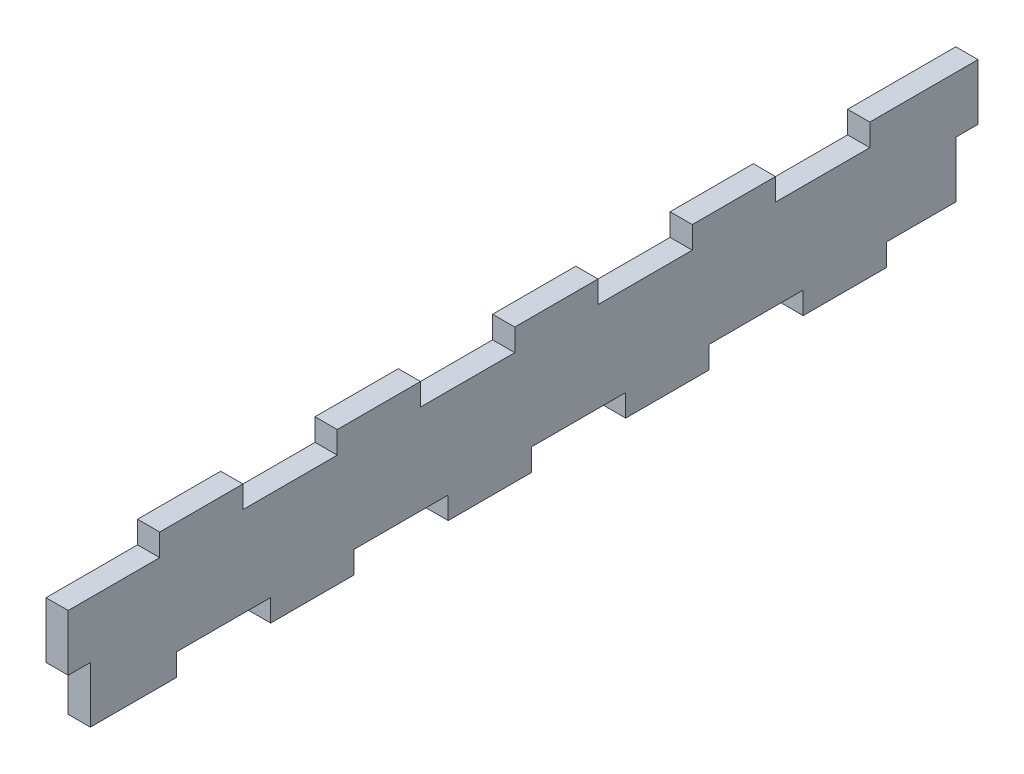
from build123d import *

# Parameters (mm, degrees)
ESQUISSE1_W             = 82
ESQUISSE1_H             = 12.11
BOSS_EXTRU_1_DEPTH      = 2
ESQUISSE2_W             = 8.5
ESQUISSE2_H             = 2.25
ENL_V_MAT_EXTRU_1_DEPTH = 42.581069992
ESQUISSE3_W             = 8.5
ESQUISSE3_H             = 2
ENL_V_MAT_EXTRU_2_DEPTH = 42.581069992
ESQUISSE4_W             = 2
ESQUISSE4_H             = 5.055
ENL_V_MAT_EXTRU_3_DEPTH = 42.581069992


with BuildPart() as part:
    # Esquisse1 → Boss.-Extru.1 (new body)
    with BuildSketch(Plane(origin=(0, 0, 0), x_dir=(0, 0, -1), z_dir=(1, 0, 0))):
        with Locations((-0.0892, 0)):
            Rectangle(ESQUISSE1_W, ESQUISSE1_H)
    extrude(amount=BOSS_EXTRU_1_DEPTH)

    # Esquisse2 → Enlèv. mat.-Extru.1 (cut, through all)
    with BuildSketch(Plane(origin=(0, 0, 0), x_dir=(0, 0, -1), z_dir=(1, 0, 0))):
        with Locations((-37.0892, 5.18)):
            Rectangle(ESQUISSE2_W, ESQUISSE2_H)
        with Locations((-21.0892, 5.18)):
            Rectangle(ESQUISSE2_W, ESQUISSE2_H)
        with Locations((-5.0892, 5.18)):
            Rectangle(ESQUISSE2_W, ESQUISSE2_H)
        with Locations((10.9108, 5.18)):
            Rectangle(ESQUISSE2_W, ESQUISSE2_H)
        with Locations((26.9108, 5.18)):
            Rectangle(ESQUISSE2_W, ESQUISSE2_H)
    extrude(amount=ENL_V_MAT_EXTRU_1_DEPTH, mode=Mode.SUBTRACT)

    # Esquisse3 → Enlèv. mat.-Extru.2 (cut, through all)
    with BuildSketch(Plane(origin=(0, 0, 0), x_dir=(0, 0, -1), z_dir=(1, 0, 0))):
        with Locations((-27.0892, -5.055)):
            Rectangle(ESQUISSE3_W, ESQUISSE3_H)
        with Locations((-11.0892, -5.055)):
            Rectangle(ESQUISSE3_W, ESQUISSE3_H)
        with Locations((4.9108, -5.055)):
            Rectangle(ESQUISSE3_W, ESQUISSE3_H)
        with Locations((20.9108, -5.055)):
            Rectangle(ESQUISSE3_W, ESQUISSE3_H)
        with Locations((36.9108, -5.055)):
            Rectangle(ESQUISSE3_W, ESQUISSE3_H)
    extrude(amount=ENL_V_MAT_EXTRU_2_DEPTH, mode=Mode.SUBTRACT)

    # Esquisse4 → Enlèv. mat.-Extru.3 (cut, through all)
    with BuildSketch(Plane(origin=(2, 0, 0), x_dir=(0, 0, -1), z_dir=(1, 0, 0))):
        with Locations((-40.0892, -3.5275)):
            Rectangle(ESQUISSE4_W, ESQUISSE4_H)
        with Locations((39.9108, -1.5275)):
            Rectangle(ESQUISSE4_W, ESQUISSE4_H)
    extrude(amount=-ENL_V_MAT_EXTRU_3_DEPTH, mode=Mode.SUBTRACT)


solid = part.part
